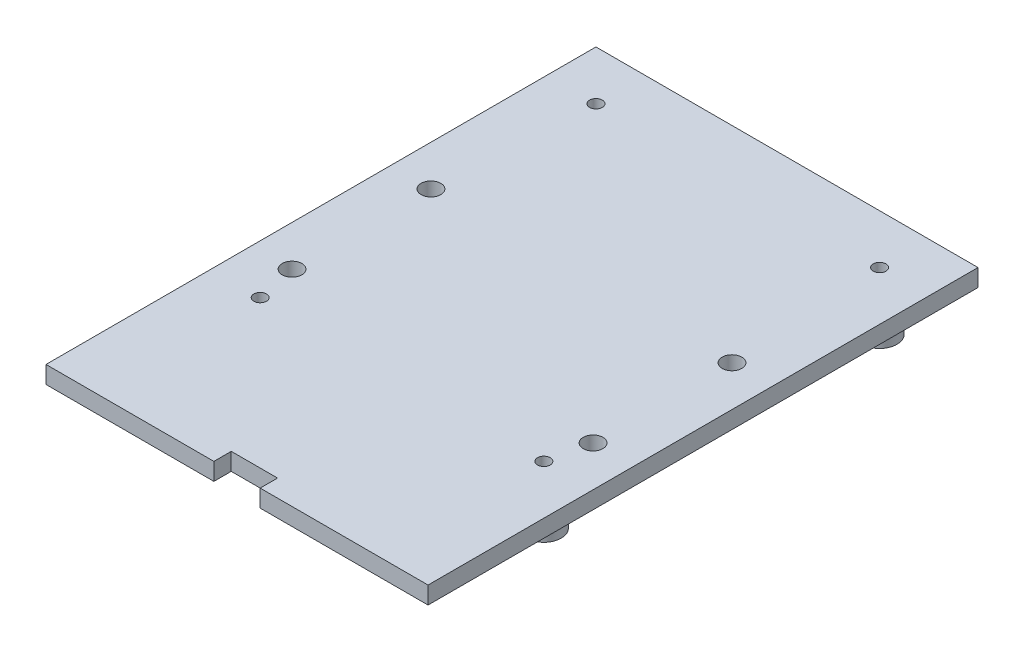
from build123d import *

# Parameters (mm, degrees)
SKETCH1_W                       = 66
SKETCH1_H                       = 95
CRADLE_BASE_DEPTH               = 3
SKETCH2_R                       = 3
STANDOFFS_DEPTH                 = 10
PILOT_AND_BOLT_HOLES_DEPTH      = 140.704151692
PILOT_AND_BOLT_HOLES_DEPTH_BACK = 140.704151692
SKETCH3_R                       = 1.1
SKETCH3_R_2                     = 1.7
USB_END_NOTCH_DEPTH             = 140.704151692
USB_END_NOTCH_DEPTH_BACK        = 140.704151692
SKETCH4_W                       = 8
SKETCH4_H                       = 4


with BuildPart() as part:
    # Sketch1 → Cradle Base (new body)
    with BuildSketch(Plane(origin=(0, 0, 0), x_dir=(1, 0, 0), z_dir=(0, 1, 0))):
        with Locations((-98, 0)):
            Rectangle(SKETCH1_W, SKETCH1_H)
    extrude(amount=-CRADLE_BASE_DEPTH)

    # Sketch2 → Standoffs (add)
    with BuildSketch(Plane(origin=(0, 0, 0), x_dir=(1, 0, 0), z_dir=(0, 1, 0))):
        with Locations((-122.5, 39)):
            Circle(SKETCH2_R)
        with Locations((-122.5, -19)):
            Circle(SKETCH2_R)
        with Locations((-73.5, 39)):
            Circle(SKETCH2_R)
        with Locations((-73.5, -19)):
            Circle(SKETCH2_R)
    extrude(amount=-STANDOFFS_DEPTH)

    # Sketch3 → Pilot and Bolt Holes (cut, two sides: drawn at the far end of the back side and taken through both)
    with BuildSketch(Plane(origin=(0, 0, 0), x_dir=(1, 0, 0), z_dir=(0, 1, 0)).offset(-PILOT_AND_BOLT_HOLES_DEPTH_BACK)):
        with Locations((-122.5, 39)):
            Circle(SKETCH3_R)
        with Locations((-122.5, -19)):
            Circle(SKETCH3_R)
        with Locations((-73.5, 39)):
            Circle(SKETCH3_R)
        with Locations((-73.5, -19)):
            Circle(SKETCH3_R)
        with Locations((-124, 12)):
            Circle(SKETCH3_R_2)
        with Locations((-124, -12)):
            Circle(SKETCH3_R_2)
        with Locations((-72, -12)):
            Circle(SKETCH3_R_2)
        with Locations((-72, 12)):
            Circle(SKETCH3_R_2)
    extrude(amount=PILOT_AND_BOLT_HOLES_DEPTH + PILOT_AND_BOLT_HOLES_DEPTH_BACK, mode=Mode.SUBTRACT)

    # Sketch4 → USB End Notch (cut, two sides: drawn at the far end of the back side and taken through both)
    with BuildSketch(Plane(origin=(0, 0, 0), x_dir=(1, 0, 0), z_dir=(0, 1, 0)).offset(-USB_END_NOTCH_DEPTH_BACK)):
        with Locations((-98, -46.5)):
            Rectangle(SKETCH4_W, SKETCH4_H)
    extrude(amount=USB_END_NOTCH_DEPTH + USB_END_NOTCH_DEPTH_BACK, mode=Mode.SUBTRACT)


solid = part.part
